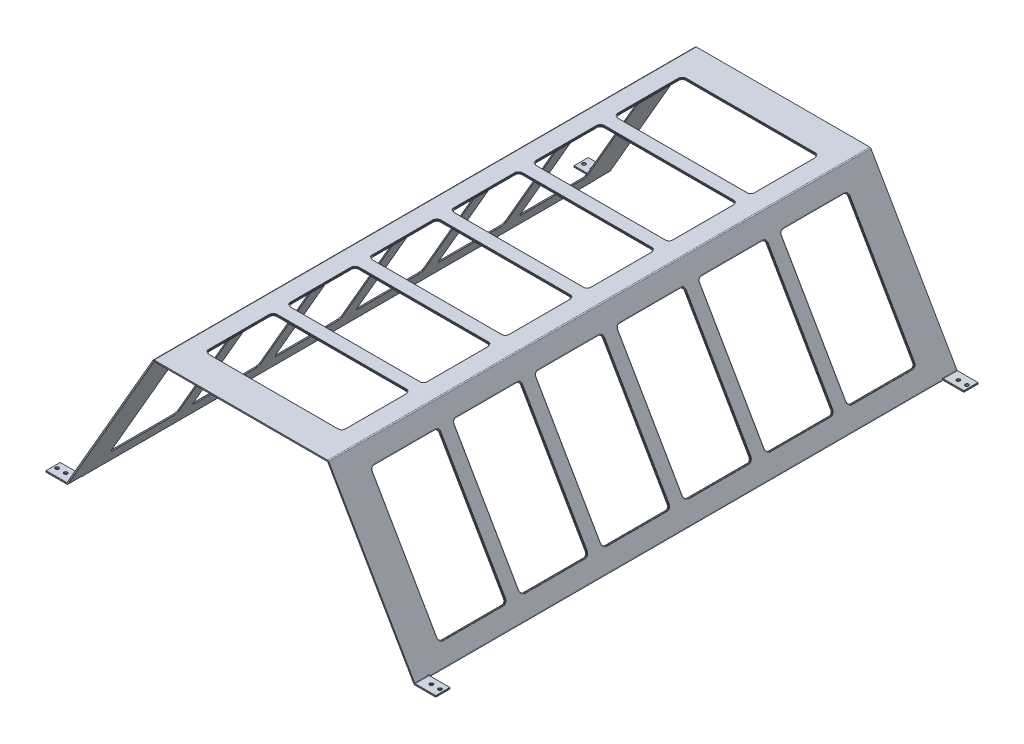
from build123d import *

# Parameters (mm, degrees)
EXTRUDE_1_DEPTH            = 633
EXTRUDE_1_DEPTH_BACK       = 633
EXTRUDE_2_DEPTH            = 633
EXTRUDE_2_DEPTH_BACK       = 633
SHEET_START                = -633
SHEET_METAL_1_DEPTH        = 1266
SHEET_METAL_1_2_DEPTH      = 1266
SHEET_METAL_2_DEPTH        = 1266
SHEET_METAL_2_2_DEPTH      = 1266
SM_START                   = -633
SM_EDGE_FLANGE_1_DEPTH     = 33.75
SM_START_2                 = -600
SM_EDGE_FLANGE_1_2_DEPTH   = 0.75
SM_EDGE_FLANGE_1_3_DEPTH   = 33
SM_EDGE_FLANGE_3_DEPTH     = 33.75
SM_EDGE_FLANGE_3_2_DEPTH   = 0.75
SM_EDGE_FLANGE_3_3_DEPTH   = 33
SKETCH_26_W                = 33
SKETCH_26_H                = 1.5
EXTRUDE_5_DEPTH            = 0.866025
SKETCH_20_W                = 33
SKETCH_20_H                = 1.5
EXTRUDE_1_2_DEPTH          = 1.299038106
SKETCH_27_W                = 33
SKETCH_27_H                = 1.5
EXTRUDE_6_DEPTH            = 0.866025404
SKETCH_23_W                = 33
SKETCH_23_H                = 1.5
EXTRUDE_2_2_DEPTH          = 1.299038106
MIRROR_START               = -633
MIRROR_2_COPY_1_DEPTH      = 33.75
MIRROR_START_2             = -600
MIRROR_2_COPY_2_DEPTH      = 0.75
MIRROR_2_COPY_3_DEPTH      = 33
SKETCH_28_W                = 33
SKETCH_28_H                = 1.5
EXTRUDE_7_DEPTH            = 0.866025404
SKETCH_29_W                = 33
SKETCH_29_H                = 1.5
EXTRUDE_8_DEPTH            = 0.866025404
MIRROR_4_COPY_1_DEPTH      = 33.75
MIRROR_4_COPY_2_DEPTH      = 0.75
MIRROR_4_COPY_3_DEPTH      = 33
SKETCH_24_W                = 33
SKETCH_24_H                = 1.5
EXTRUDE_3_DEPTH            = 1.299038106
SKETCH_25_W                = 33
SKETCH_25_H                = 1.5
EXTRUDE_4_DEPTH            = 1.299038106
CUT_EXTRUDE_1_DEPTH        = 856.137078446
CUT_EXTRUDE_1_DEPTH_BACK   = 856.137078446
SKETCH_9_R                 = 4
OTHER_START                = 356.740288533
OTHER_3_DEPTH              = 3
OTHER_START_2              = 358.240288533
OTHER_3_2_DEPTH            = 1.5
PATTERN_LINEAR_2_COUNT     = 3
PATTERN_LINEAR_2_PITCH     = 191
MIRROR_START_3             = 356.740288533
MIRROR_5_DEPTH             = 3
MIRROR_START_4             = 358.240288533
MIRROR_5_2_DEPTH           = 1.5
PATTERN_START              = -356.740288533
PATTERN_CIRCULAR_2_DEPTH   = 3
PATTERN_CIRCULAR_2_2_DEPTH = 1.5
PATTERN_START_2            = 353.740288533
PATTERN_CIRCULAR_2_3_DEPTH = 3
PATTERN_START_3            = 355.240288533
PATTERN_CIRCULAR_2_4_DEPTH = 1.5


# Read off the part's stored shape, not the designer's step: Преобразовать-Твердое тело1, Преобразовать-Твердое тело2, Ребро-кромка1, Ребро-кромка3, Полость3, Зеркальное отражение5, Круговой массив2
with BuildPart() as part:
    # Sketch 1 → Extrude 1 (new, two sides: drawn at the far end of the back side and taken through both)
    with BuildSketch(Plane.XY.offset(-EXTRUDE_1_DEPTH_BACK)):
        Polygon((405, 6), (202.5, 356.740288533), (-202.5, 356.740288533), (-405, 6), (-406.299038106, 6.75), (-203.366025404, 358.240288533), (203.366025404, 358.240288533), (406.299038106, 6.75), align=None)
    extrude(amount=EXTRUDE_1_DEPTH + EXTRUDE_1_DEPTH_BACK)

    # Sheet Metal 1 outline → Sheet Metal 1 (cut)
    with BuildSketch(Plane.XY.offset(SHEET_START)):
        with BuildLine():
            Line((203.366025404, 358.240288533), (201.633974596, 358.240288533))
            ThreePointArc((201.633974596, 358.240288533), (203.133974596, 357.838364744), (204.232050808, 356.740288533))
            Line((204.232050808, 356.740288533), (203.366025404, 358.240288533))
        make_face()
        with BuildLine():
            ThreePointArc((-204.232050808, 356.740288533), (-203.133974596, 357.838364744), (-201.633974596, 358.240288533))
            Line((-201.633974596, 358.240288533), (-203.366025404, 358.240288533))
            Line((-203.366025404, 358.240288533), (-204.232050808, 356.740288533))
        make_face()
    extrude(amount=SHEET_METAL_1_DEPTH, mode=Mode.SUBTRACT)

    # Sheet Metal 1 2 outline → Sheet Metal 1 2 (add)
    with BuildSketch(Plane.XY.offset(SHEET_START)):
        with BuildLine():
            Line((202.5, 356.740288533), (201.633974596, 356.740288533))
            ThreePointArc((201.633974596, 356.740288533), (202.383974596, 356.539326638), (202.933012702, 355.990288533))
            Line((202.933012702, 355.990288533), (202.5, 356.740288533))
        make_face()
        with BuildLine():
            ThreePointArc((-202.933012702, 355.990288533), (-202.383974596, 356.539326638), (-201.633974596, 356.740288533))
            Line((-201.633974596, 356.740288533), (-202.5, 356.740288533))
            Line((-202.5, 356.740288533), (-202.933012702, 355.990288533))
        make_face()
    extrude(amount=SHEET_METAL_1_2_DEPTH)

    # Ребро-кромка1 outline → Ребро-кромка1 (cut)
    with BuildSketch(Plane.XY.offset(SM_START)):
        with BuildLine():
            Line((-405, 6), (-403.700961894, 8.25))
            ThreePointArc((-403.700961894, 8.25), (-404.799038106, 7.151923789), (-406.299038106, 6.75))
            Line((-406.299038106, 6.75), (-405, 6))
        make_face()
    sm_edge_flange_1 = extrude(amount=SM_EDGE_FLANGE_1_DEPTH, mode=Mode.SUBTRACT)

    # Sm Edge Flange 1 2 outline → Sm Edge Flange 1 2 (cut)
    with BuildSketch(Plane.XY.offset(SM_START_2)):
        with BuildLine():
            Line((-403.325961894, 8.899519053), (-404.625, 9.649519053))
            Line((-404.625, 9.649519053), (-406.299038106, 6.75))
            ThreePointArc((-406.299038106, 6.75), (-404.799038106, 7.151923789), (-403.700961894, 8.25))
            Line((-403.700961894, 8.25), (-403.325961894, 8.899519053))
        make_face()
    sm_edge_flange_1_2 = extrude(amount=SM_EDGE_FLANGE_1_2_DEPTH, mode=Mode.SUBTRACT)

    # Sm Edge Flange 1 3 outline → Sm Edge Flange 1 3 (add)
    with BuildSketch(Plane.XY.offset(SM_START)):
        with BuildLine():
            Line((-406.299038106, 6.75), (-405, 9))
            ThreePointArc((-405, 9), (-405.549038106, 8.450961894), (-406.299038106, 8.25))
            Line((-406.299038106, 8.25), (-454.133974596, 8.25))
            Line((-454.133974596, 8.25), (-454.133974596, 6.75))
            Line((-454.133974596, 6.75), (-406.299038106, 6.75))
        make_face()
    sm_edge_flange_1_3 = extrude(amount=SM_EDGE_FLANGE_1_3_DEPTH)

    # Эскиз26 → Бобышка-Вытянуть5 (add)
    with BuildSketch(Plane.ZY.offset(454.133974596)):
        with Locations((-616.5, 7.5)):
            Rectangle(SKETCH_26_W, SKETCH_26_H)
    extrude(amount=EXTRUDE_5_DEPTH)

    # Зеркальное отражение1: Ребро-кромка1, Sm Edge Flange 1 2 across plane
    add(sm_edge_flange_1.mirror(Plane.XY), mode=Mode.SUBTRACT)
    add(sm_edge_flange_1_2.mirror(Plane.XY), mode=Mode.SUBTRACT)

    # Mirror 1 2: Sm Edge Flange 1 3 across plane
    add(sm_edge_flange_1_3.mirror(Plane.XY))

    # Эскиз27 → Бобышка-Вытянуть6 (add)
    with BuildSketch(Plane.ZY.offset(454.133974596)):
        with Locations((616.5, 7.5)):
            Rectangle(SKETCH_27_W, SKETCH_27_H)
    extrude(amount=EXTRUDE_6_DEPTH)

    # Зеркальное отражение2: Ребро-кромка1, Sm Edge Flange 1 2, Sm Edge Flange 1 3 across plane
    add(sm_edge_flange_1.mirror(Plane(origin=(0, 0, 0), x_dir=(0, 0, 1), z_dir=(1, 0, 0))), mode=Mode.SUBTRACT)
    add(sm_edge_flange_1_2.mirror(Plane(origin=(0, 0, 0), x_dir=(0, 0, 1), z_dir=(1, 0, 0))), mode=Mode.SUBTRACT)
    add(sm_edge_flange_1_3.mirror(Plane(origin=(0, 0, 0), x_dir=(0, 0, 1), z_dir=(1, 0, 0))))

    # Зеркальное отражение2 copy 1 sketch → Зеркальное отражение2 copy 1 (cut)
    with BuildSketch(Plane(origin=(0, 0, 0), x_dir=(-1, 0, 0), z_dir=(0, 0, -1)).offset(MIRROR_START)):
        with BuildLine():
            Line((-405, 6), (-403.700961894, 8.25))
            ThreePointArc((-403.700961894, 8.25), (-404.799038106, 7.151923789), (-406.299038106, 6.75))
            Line((-406.299038106, 6.75), (-405, 6))
        make_face()
    extrude(amount=MIRROR_2_COPY_1_DEPTH, mode=Mode.SUBTRACT)

    # Зеркальное отражение2 copy 2 sketch → Зеркальное отражение2 copy 2 (cut)
    with BuildSketch(Plane(origin=(0, 0, 0), x_dir=(-1, 0, 0), z_dir=(0, 0, -1)).offset(MIRROR_START_2)):
        with BuildLine():
            Line((-403.325961894, 8.899519053), (-404.625, 9.649519053))
            Line((-404.625, 9.649519053), (-406.299038106, 6.75))
            ThreePointArc((-406.299038106, 6.75), (-404.799038106, 7.151923789), (-403.700961894, 8.25))
            Line((-403.700961894, 8.25), (-403.325961894, 8.899519053))
        make_face()
    extrude(amount=MIRROR_2_COPY_2_DEPTH, mode=Mode.SUBTRACT)

    # Зеркальное отражение2 copy 3 sketch → Зеркальное отражение2 copy 3 (add)
    with BuildSketch(Plane(origin=(0, 0, 0), x_dir=(-1, 0, 0), z_dir=(0, 0, -1)).offset(MIRROR_START)):
        with BuildLine():
            Line((-406.299038106, 6.75), (-405, 9))
            ThreePointArc((-405, 9), (-405.549038106, 8.450961894), (-406.299038106, 8.25))
            Line((-406.299038106, 8.25), (-454.133974596, 8.25))
            Line((-454.133974596, 8.25), (-454.133974596, 6.75))
            Line((-454.133974596, 6.75), (-406.299038106, 6.75))
        make_face()
    extrude(amount=MIRROR_2_COPY_3_DEPTH)

    # Эскиз28 → Бобышка-Вытянуть7 (add)
    with BuildSketch(Plane(origin=(454.133974596, 0, 0), x_dir=(0, 0, -1), z_dir=(1, 0, 0))):
        with Locations((616.5, 7.5)):
            Rectangle(SKETCH_28_W, SKETCH_28_H)
    extrude(amount=EXTRUDE_7_DEPTH)

    # Эскиз29 → Бобышка-Вытянуть8 (add)
    with BuildSketch(Plane(origin=(454.133974596, 0, 0), x_dir=(0, 0, -1), z_dir=(1, 0, 0))):
        with Locations((-616.5, 7.5)):
            Rectangle(SKETCH_29_W, SKETCH_29_H)
    extrude(amount=EXTRUDE_8_DEPTH)


with BuildPart() as body_2:
    # Эскиз11 → Extrude 2 (new, two sides: drawn at the far end of the back side and taken through both)
    with BuildSketch(Plane.XY.offset(-EXTRUDE_2_DEPTH_BACK)):
        Polygon((405.299038106, 8.482050808), (203.366025404, 358.240288533), (-203.366025404, 358.240288533), (-405.299038106, 8.482050808), (-406.598076211, 9.232050808), (-204.232050808, 359.740288533), (204.232050808, 359.740288533), (406.598076211, 9.232050808), align=None)
    extrude(amount=EXTRUDE_2_DEPTH + EXTRUDE_2_DEPTH_BACK)

    # Sheet Metal 2 outline → Sheet Metal 2 (cut)
    with BuildSketch(Plane.XY.offset(SHEET_START)):
        with BuildLine():
            ThreePointArc((-205.098076211, 358.240288533), (-204, 359.338364744), (-202.5, 359.740288533))
            Line((-202.5, 359.740288533), (-204.232050808, 359.740288533))
            Line((-204.232050808, 359.740288533), (-205.098076211, 358.240288533))
        make_face()
        with BuildLine():
            ThreePointArc((202.5, 359.740288533), (204, 359.338364744), (205.098076211, 358.240288533))
            Line((205.098076211, 358.240288533), (204.232050808, 359.740288533))
            Line((204.232050808, 359.740288533), (202.5, 359.740288533))
        make_face()
    extrude(amount=SHEET_METAL_2_DEPTH, mode=Mode.SUBTRACT)

    # Sheet Metal 2 2 outline → Sheet Metal 2 2 (add)
    with BuildSketch(Plane.XY.offset(SHEET_START)):
        with BuildLine():
            ThreePointArc((-203.799038106, 357.490288533), (-203.25, 358.039326638), (-202.5, 358.240288533))
            Line((-202.5, 358.240288533), (-203.366025404, 358.240288533))
            Line((-203.366025404, 358.240288533), (-203.799038106, 357.490288533))
        make_face()
        with BuildLine():
            ThreePointArc((202.5, 358.240288533), (203.25, 358.039326638), (203.799038106, 357.490288533))
            Line((203.799038106, 357.490288533), (203.366025404, 358.240288533))
            Line((203.366025404, 358.240288533), (202.5, 358.240288533))
        make_face()
    extrude(amount=SHEET_METAL_2_2_DEPTH)

    # Ребро-кромка3 outline → Ребро-кромка3 (cut)
    with BuildSketch(Plane.XY.offset(SM_START)):
        with BuildLine():
            Line((-405.299038106, 8.482050808), (-404.433012702, 9.982050808))
            ThreePointArc((-404.433012702, 9.982050808), (-405.009426897, 9.265548452), (-405.775793973, 8.757305936))
            Line((-405.775793973, 8.757305936), (-405.299038106, 8.482050808))
        make_face()
    sm_edge_flange_3 = extrude(amount=SM_EDGE_FLANGE_3_DEPTH, mode=Mode.SUBTRACT)

    # Sm Edge Flange 3 2 outline → Sm Edge Flange 3 2 (cut)
    with BuildSketch(Plane.XY.offset(SM_START_2)):
        with BuildLine():
            Line((-404.058012702, 10.63156986), (-405.357050808, 11.38156986))
            Line((-405.357050808, 11.38156986), (-406.598076211, 9.232050808))
            Line((-406.598076211, 9.232050808), (-405.775793973, 8.757305936))
            ThreePointArc((-405.775793973, 8.757305936), (-405.009426897, 9.265548452), (-404.433012702, 9.982050808))
            Line((-404.433012702, 9.982050808), (-404.058012702, 10.63156986))
        make_face()
    sm_edge_flange_3_2 = extrude(amount=SM_EDGE_FLANGE_3_2_DEPTH, mode=Mode.SUBTRACT)

    # Sm Edge Flange 3 3 outline → Sm Edge Flange 3 3 (add)
    with BuildSketch(Plane.XY.offset(SM_START)):
        with BuildLine():
            Line((-406.598076211, 9.232050808), (-405.732050808, 10.732050808))
            ThreePointArc((-405.732050808, 10.732050808), (-406.281088913, 10.183012702), (-407.031088913, 9.982050808))
            Line((-407.031088913, 9.982050808), (-453.700961894, 9.982050808))
            Line((-453.700961894, 9.982050808), (-453.700961894, 8.482050808))
            Line((-453.700961894, 8.482050808), (-407.031088913, 8.482050808))
            ThreePointArc((-407.031088913, 8.482050808), (-406.388529427, 8.551672452), (-405.775793973, 8.757305936))
            Line((-405.775793973, 8.757305936), (-406.598076211, 9.232050808))
        make_face()
    sm_edge_flange_3_3 = extrude(amount=SM_EDGE_FLANGE_3_3_DEPTH)

    # Эскиз20 → Extrude 1 2 (add)
    with BuildSketch(Plane.ZY.offset(453.700961894)):
        with Locations((-616.5, 9.232050808)):
            Rectangle(SKETCH_20_W, SKETCH_20_H)
    extrude(amount=EXTRUDE_1_2_DEPTH)

    # Зеркальное отражение3: Ребро-кромка3, Sm Edge Flange 3 2 across plane
    add(sm_edge_flange_3.mirror(Plane.XY), mode=Mode.SUBTRACT)
    add(sm_edge_flange_3_2.mirror(Plane.XY), mode=Mode.SUBTRACT)

    # Mirror 3 2: Sm Edge Flange 3 3 across plane
    add(sm_edge_flange_3_3.mirror(Plane.XY))

    # Эскиз23 → Extrude 2 2 (add)
    with BuildSketch(Plane.ZY.offset(453.700961894)):
        with Locations((616.5, 9.232050808)):
            Rectangle(SKETCH_23_W, SKETCH_23_H)
    extrude(amount=EXTRUDE_2_2_DEPTH)

    # Зеркальное отражение4: Ребро-кромка3, Sm Edge Flange 3 2, Sm Edge Flange 3 3 across plane
    add(sm_edge_flange_3.mirror(Plane(origin=(0, 0, 0), x_dir=(0, 0, 1), z_dir=(1, 0, 0))), mode=Mode.SUBTRACT)
    add(sm_edge_flange_3_2.mirror(Plane(origin=(0, 0, 0), x_dir=(0, 0, 1), z_dir=(1, 0, 0))), mode=Mode.SUBTRACT)
    add(sm_edge_flange_3_3.mirror(Plane(origin=(0, 0, 0), x_dir=(0, 0, 1), z_dir=(1, 0, 0))))

    # Зеркальное отражение4 copy 1 sketch → Зеркальное отражение4 copy 1 (cut)
    with BuildSketch(Plane(origin=(0, 0, 0), x_dir=(-1, 0, 0), z_dir=(0, 0, -1)).offset(MIRROR_START)):
        with BuildLine():
            Line((-405.299038106, 8.482050808), (-404.433012702, 9.982050808))
            ThreePointArc((-404.433012702, 9.982050808), (-405.009426897, 9.265548452), (-405.775793973, 8.757305936))
            Line((-405.775793973, 8.757305936), (-405.299038106, 8.482050808))
        make_face()
    extrude(amount=MIRROR_4_COPY_1_DEPTH, mode=Mode.SUBTRACT)

    # Зеркальное отражение4 copy 2 sketch → Зеркальное отражение4 copy 2 (cut)
    with BuildSketch(Plane(origin=(0, 0, 0), x_dir=(-1, 0, 0), z_dir=(0, 0, -1)).offset(MIRROR_START_2)):
        with BuildLine():
            Line((-404.058012702, 10.63156986), (-405.357050808, 11.38156986))
            Line((-405.357050808, 11.38156986), (-406.598076211, 9.232050808))
            Line((-406.598076211, 9.232050808), (-405.775793973, 8.757305936))
            ThreePointArc((-405.775793973, 8.757305936), (-405.009426897, 9.265548452), (-404.433012702, 9.982050808))
            Line((-404.433012702, 9.982050808), (-404.058012702, 10.63156986))
        make_face()
    extrude(amount=MIRROR_4_COPY_2_DEPTH, mode=Mode.SUBTRACT)

    # Зеркальное отражение4 copy 3 sketch → Зеркальное отражение4 copy 3 (add)
    with BuildSketch(Plane(origin=(0, 0, 0), x_dir=(-1, 0, 0), z_dir=(0, 0, -1)).offset(MIRROR_START)):
        with BuildLine():
            Line((-406.598076211, 9.232050808), (-405.732050808, 10.732050808))
            ThreePointArc((-405.732050808, 10.732050808), (-406.281088913, 10.183012702), (-407.031088913, 9.982050808))
            Line((-407.031088913, 9.982050808), (-453.700961894, 9.982050808))
            Line((-453.700961894, 9.982050808), (-453.700961894, 8.482050808))
            Line((-453.700961894, 8.482050808), (-407.031088913, 8.482050808))
            ThreePointArc((-407.031088913, 8.482050808), (-406.388529427, 8.551672452), (-405.775793973, 8.757305936))
            Line((-405.775793973, 8.757305936), (-406.598076211, 9.232050808))
        make_face()
    extrude(amount=MIRROR_4_COPY_3_DEPTH)

    # Эскиз24 → Бобышка-Вытянуть3 (add)
    with BuildSketch(Plane(origin=(453.700961894, 0, 0), x_dir=(0, 0, -1), z_dir=(1, 0, 0))):
        with Locations((616.5, 9.232050808)):
            Rectangle(SKETCH_24_W, SKETCH_24_H)
    extrude(amount=EXTRUDE_3_DEPTH)

    # Эскиз25 → Бобышка-Вытянуть4 (add)
    with BuildSketch(Plane(origin=(453.700961894, 0, 0), x_dir=(0, 0, -1), z_dir=(1, 0, 0))):
        with Locations((-616.5, 9.232050808)):
            Rectangle(SKETCH_25_W, SKETCH_25_H)
    extrude(amount=EXTRUDE_4_DEPTH)


with BuildPart() as cut_extrude_1_tool:
    # Эскиз9 → Вырез-Вытянуть1 (new, two sides: drawn at the far end of the back side and taken through both)
    with BuildSketch(Plane(origin=(0, 8.25, 0), x_dir=(1, 0, 0), z_dir=(0, 1, 0)).offset(-CUT_EXTRUDE_1_DEPTH_BACK)):
        with Locations(Location((-447, 615, 0), (0, 0, 180))):
            Circle(SKETCH_9_R)
        with Locations(Location((-427, 615, 0), (0, 0, 180))):
            Circle(SKETCH_9_R)
        with Locations(Location((-447, -615, 0), (0, 0, 180))):
            Circle(SKETCH_9_R)
        with Locations(Location((-427, -615, 0), (0, 0, 180))):
            Circle(SKETCH_9_R)
        with Locations(Location((427, -615, 0), (0, 0, 180))):
            Circle(SKETCH_9_R)
        with Locations(Location((447, -615, 0), (0, 0, 180))):
            Circle(SKETCH_9_R)
        with Locations(Location((447, 615, 0), (0, 0, 180))):
            Circle(SKETCH_9_R)
        with Locations(Location((427, 615, 0), (0, 0, 180))):
            Circle(SKETCH_9_R)
    extrude(amount=CUT_EXTRUDE_1_DEPTH + CUT_EXTRUDE_1_DEPTH_BACK)


with BuildPart() as part_1:
    add(part.part)

    # Вырез-Вытянуть1: cut by cut_extrude_1_tool
    add(cut_extrude_1_tool.part, mode=Mode.SUBTRACT)


with BuildPart() as body_2_1:
    add(body_2.part)

    # Вырез-Вытянуть1: cut by cut_extrude_1_tool
    add(cut_extrude_1_tool.part, mode=Mode.SUBTRACT)


with BuildPart() as other_3_tool:
    # Полость3 outline → Полость3 (new body)
    with BuildSketch(Plane(origin=(0, 0, 0), x_dir=(1, 0, 0), z_dir=(0, 1, 0)).offset(OTHER_START)):
        with BuildLine():
            Line((158.5, 25), (158.5, 166))
            ThreePointArc((158.5, 166), (156.156854249, 171.656854249), (150.5, 174))
            Line((150.5, 174), (-150.5, 174))
            ThreePointArc((-150.5, 174), (-156.156854249, 171.656854249), (-158.5, 166))
            Line((-158.5, 166), (-158.5, 25))
            ThreePointArc((-158.5, 25), (-156.156854249, 19.343145751), (-150.5, 17))
            Line((-150.5, 17), (150.5, 17))
            ThreePointArc((150.5, 17), (156.156854249, 19.343145751), (158.5, 25))
        make_face()
    other_3 = extrude(amount=OTHER_3_DEPTH)


with BuildPart() as part_2:
    add(part_1.part)

    # Полость3: cut by other_3_tool
    add(other_3_tool.part, mode=Mode.SUBTRACT)


with BuildPart() as body_2_2:
    add(body_2_1.part)

    # Полость3: cut by other_3_tool
    add(other_3_tool.part, mode=Mode.SUBTRACT)

    # Other 3 2 outline → Other 3 2 (cut)
    with BuildSketch(Plane(origin=(0, 0, 0), x_dir=(1, 0, 0), z_dir=(0, 1, 0)).offset(OTHER_START_2)):
        with BuildLine():
            ThreePointArc((160.5, 166), (157.571067812, 173.071067812), (150.5, 176))
            Line((150.5, 176), (-150.5, 176))
            ThreePointArc((-150.5, 176), (-157.571067812, 173.071067812), (-160.5, 166))
            Line((-160.5, 166), (-160.5, 25))
            ThreePointArc((-160.5, 25), (-157.571067812, 17.928932188), (-150.5, 15))
            Line((-150.5, 15), (150.5, 15))
            ThreePointArc((150.5, 15), (157.571067812, 17.928932188), (160.5, 25))
            Line((160.5, 25), (160.5, 166))
        make_face()
        with BuildLine():
            ThreePointArc((150.5, 174), (156.156854249, 171.656854249), (158.5, 166))
            Line((158.5, 166), (158.5, 25))
            ThreePointArc((158.5, 25), (156.156854249, 19.343145751), (150.5, 17))
            Line((150.5, 17), (-150.5, 17))
            ThreePointArc((-150.5, 17), (-156.156854249, 19.343145751), (-158.5, 25))
            Line((-158.5, 25), (-158.5, 166))
            ThreePointArc((-158.5, 166), (-156.156854249, 171.656854249), (-150.5, 174))
            Line((-150.5, 174), (150.5, 174))
        make_face(mode=Mode.SUBTRACT)
    other_3_2 = extrude(amount=OTHER_3_2_DEPTH, mode=Mode.SUBTRACT)


with BuildPart() as pattern_linear_2_tool:
    # Линейный массив2: Полость3, Other 3 2 ×3
    with Locations(*[(0, 0, -i * PATTERN_LINEAR_2_PITCH) for i in range(1, PATTERN_LINEAR_2_COUNT)]):
        add(other_3)
        add(other_3_2)


with BuildPart() as part_3:
    add(part_2.part)

    # Линейный массив2: cut by pattern_linear_2_tool
    add(pattern_linear_2_tool.part, mode=Mode.SUBTRACT)


with BuildPart() as body_2_3:
    add(body_2_2.part)

    # Линейный массив2: cut by pattern_linear_2_tool
    add(pattern_linear_2_tool.part, mode=Mode.SUBTRACT)


with BuildPart() as mirror_5_tool:
    # Зеркальное отражение5 outline → Зеркальное отражение5 (new body)
    with BuildSketch(Plane(origin=(0, 0, 0), x_dir=(1, 0, 0), z_dir=(0, 1, 0)).offset(MIRROR_START_3)):
        with BuildLine():
            ThreePointArc((150.5, -365), (156.156854249, -362.656854249), (158.5, -357))
            Line((158.5, -357), (158.5, -216))
            ThreePointArc((158.5, -216), (156.156854249, -210.343145751), (150.5, -208))
            Line((150.5, -208), (-150.5, -208))
            ThreePointArc((-150.5, -208), (-156.156854249, -210.343145751), (-158.5, -216))
            Line((-158.5, -216), (-158.5, -357))
            ThreePointArc((-158.5, -357), (-156.156854249, -362.656854249), (-150.5, -365))
            Line((-150.5, -365), (150.5, -365))
        make_face()
        with BuildLine():
            ThreePointArc((150.5, -174), (156.156854249, -171.656854249), (158.5, -166))
            Line((158.5, -166), (158.5, -25))
            ThreePointArc((158.5, -25), (156.156854249, -19.343145751), (150.5, -17))
            Line((150.5, -17), (-150.5, -17))
            ThreePointArc((-150.5, -17), (-156.156854249, -19.343145751), (-158.5, -25))
            Line((-158.5, -25), (-158.5, -166))
            ThreePointArc((-158.5, -166), (-156.156854249, -171.656854249), (-150.5, -174))
            Line((-150.5, -174), (150.5, -174))
        make_face()
        with BuildLine():
            ThreePointArc((150.5, -556), (156.156854249, -553.656854249), (158.5, -548))
            Line((158.5, -548), (158.5, -407))
            ThreePointArc((158.5, -407), (156.156854249, -401.343145751), (150.5, -399))
            Line((150.5, -399), (-150.5, -399))
            ThreePointArc((-150.5, -399), (-156.156854249, -401.343145751), (-158.5, -407))
            Line((-158.5, -407), (-158.5, -548))
            ThreePointArc((-158.5, -548), (-156.156854249, -553.656854249), (-150.5, -556))
            Line((-150.5, -556), (150.5, -556))
        make_face()
    extrude(amount=MIRROR_5_DEPTH)


with BuildPart() as part_4:
    add(part_3.part)

    # Зеркальное отражение5: cut by mirror_5_tool
    add(mirror_5_tool.part, mode=Mode.SUBTRACT)


with BuildPart() as body_2_4:
    add(body_2_3.part)

    # Зеркальное отражение5: cut by mirror_5_tool
    add(mirror_5_tool.part, mode=Mode.SUBTRACT)

    # Mirror 5 2 outline → Mirror 5 2 (cut)
    # profile 1 of 3: a face of its own
    with BuildSketch(Plane(origin=(0, 0, 0), x_dir=(1, 0, 0), z_dir=(0, 1, 0)).offset(MIRROR_START_4)):
        with BuildLine():
            ThreePointArc((-150.5, -206), (-157.571067812, -208.928932188), (-160.5, -216))
            Line((-160.5, -216), (-160.5, -357))
            ThreePointArc((-160.5, -357), (-157.571067812, -364.071067812), (-150.5, -367))
            Line((-150.5, -367), (150.5, -367))
            ThreePointArc((150.5, -367), (157.571067812, -364.071067812), (160.5, -357))
            Line((160.5, -357), (160.5, -216))
            ThreePointArc((160.5, -216), (157.571067812, -208.928932188), (150.5, -206))
            Line((150.5, -206), (-150.5, -206))
        make_face()
        with BuildLine():
            Line((158.5, -216), (158.5, -357))
            ThreePointArc((158.5, -357), (156.156854249, -362.656854249), (150.5, -365))
            Line((150.5, -365), (-150.5, -365))
            ThreePointArc((-150.5, -365), (-156.156854249, -362.656854249), (-158.5, -357))
            Line((-158.5, -357), (-158.5, -216))
            ThreePointArc((-158.5, -216), (-156.156854249, -210.343145751), (-150.5, -208))
            Line((-150.5, -208), (150.5, -208))
            ThreePointArc((150.5, -208), (156.156854249, -210.343145751), (158.5, -216))
        make_face(mode=Mode.SUBTRACT)
    # profile 2 of 3: a face of its own
    with BuildSketch(Plane(origin=(0, 0, 0), x_dir=(1, 0, 0), z_dir=(0, 1, 0)).offset(MIRROR_START_4)):
        with BuildLine():
            ThreePointArc((-150.5, -15), (-157.571067812, -17.928932188), (-160.5, -25))
            Line((-160.5, -25), (-160.5, -166))
            ThreePointArc((-160.5, -166), (-157.571067812, -173.071067812), (-150.5, -176))
            Line((-150.5, -176), (150.5, -176))
            ThreePointArc((150.5, -176), (157.571067812, -173.071067812), (160.5, -166))
            Line((160.5, -166), (160.5, -25))
            ThreePointArc((160.5, -25), (157.571067812, -17.928932188), (150.5, -15))
            Line((150.5, -15), (-150.5, -15))
        make_face()
        with BuildLine():
            Line((158.5, -25), (158.5, -166))
            ThreePointArc((158.5, -166), (156.156854249, -171.656854249), (150.5, -174))
            Line((150.5, -174), (-150.5, -174))
            ThreePointArc((-150.5, -174), (-156.156854249, -171.656854249), (-158.5, -166))
            Line((-158.5, -166), (-158.5, -25))
            ThreePointArc((-158.5, -25), (-156.156854249, -19.343145751), (-150.5, -17))
            Line((-150.5, -17), (150.5, -17))
            ThreePointArc((150.5, -17), (156.156854249, -19.343145751), (158.5, -25))
        make_face(mode=Mode.SUBTRACT)
    # profile 3 of 3: a face of its own
    with BuildSketch(Plane(origin=(0, 0, 0), x_dir=(1, 0, 0), z_dir=(0, 1, 0)).offset(MIRROR_START_4)):
        with BuildLine():
            ThreePointArc((-150.5, -397), (-157.571067812, -399.928932188), (-160.5, -407))
            Line((-160.5, -407), (-160.5, -548))
            ThreePointArc((-160.5, -548), (-157.571067812, -555.071067812), (-150.5, -558))
            Line((-150.5, -558), (150.5, -558))
            ThreePointArc((150.5, -558), (157.571067812, -555.071067812), (160.5, -548))
            Line((160.5, -548), (160.5, -407))
            ThreePointArc((160.5, -407), (157.571067812, -399.928932188), (150.5, -397))
            Line((150.5, -397), (-150.5, -397))
        make_face()
        with BuildLine():
            Line((158.5, -407), (158.5, -548))
            ThreePointArc((158.5, -548), (156.156854249, -553.656854249), (150.5, -556))
            Line((150.5, -556), (-150.5, -556))
            ThreePointArc((-150.5, -556), (-156.156854249, -553.656854249), (-158.5, -548))
            Line((-158.5, -548), (-158.5, -407))
            ThreePointArc((-158.5, -407), (-156.156854249, -401.343145751), (-150.5, -399))
            Line((-150.5, -399), (150.5, -399))
            ThreePointArc((150.5, -399), (156.156854249, -401.343145751), (158.5, -407))
        make_face(mode=Mode.SUBTRACT)
    extrude(amount=MIRROR_5_2_DEPTH, mode=Mode.SUBTRACT)


with BuildPart() as pattern_circular_2_tool:
    # Круговой массив2 outline → Круговой массив2 (new body)
    with BuildSketch(Plane(origin=(0, 0, 0), x_dir=(0.5000000000000098, 0.8660254037844329, 0), z_dir=(0.8660254037844329, -0.50000000000001, 0)).offset(PATTERN_START)):
        with BuildLine():
            ThreePointArc((163.696152423, -25), (161.353006672, -19.343145751), (155.696152423, -17))
            Line((155.696152423, -17), (-145.303847577, -17))
            ThreePointArc((-145.303847577, -17), (-150.960701827, -19.34314575), (-153.303847577, -25))
            Line((-153.303847577, -25), (-153.303847577, -166))
            ThreePointArc((-153.303847577, -166), (-150.960701827, -171.656854249), (-145.303847577, -174))
            Line((-145.303847577, -174), (155.696152423, -174))
            ThreePointArc((155.696152423, -174), (161.353006672, -171.656854249), (163.696152423, -166))
            Line((163.696152423, -166), (163.696152423, -25))
        make_face()
        with BuildLine():
            ThreePointArc((163.696152423, -407), (161.353006672, -401.343145751), (155.696152423, -399))
            Line((155.696152423, -399), (-145.303847577, -399))
            ThreePointArc((-145.303847577, -399), (-150.960701827, -401.343145751), (-153.303847577, -407))
            Line((-153.303847577, -407), (-153.303847577, -548))
            ThreePointArc((-153.303847577, -548), (-150.960701827, -553.65685425), (-145.303847577, -556))
            Line((-145.303847577, -556), (155.696152423, -556))
            ThreePointArc((155.696152423, -556), (161.353006672, -553.656854249), (163.696152423, -548))
            Line((163.696152423, -548), (163.696152423, -407))
        make_face()
        with BuildLine():
            ThreePointArc((163.696152423, -216), (161.353006672, -210.343145751), (155.696152423, -208))
            Line((155.696152423, -208), (-145.303847577, -208))
            ThreePointArc((-145.303847577, -208), (-150.960701827, -210.343145751), (-153.303847577, -216))
            Line((-153.303847577, -216), (-153.303847577, -357))
            ThreePointArc((-153.303847577, -357), (-150.960701827, -362.656854249), (-145.303847577, -365))
            Line((-145.303847577, -365), (155.696152423, -365))
            ThreePointArc((155.696152423, -365), (161.353006672, -362.656854249), (163.696152423, -357))
            Line((163.696152423, -357), (163.696152423, -216))
        make_face()
        with BuildLine():
            ThreePointArc((-153.303847577, 216), (-150.960701827, 210.343145751), (-145.303847577, 208))
            Line((-145.303847577, 208), (155.696152423, 208))
            ThreePointArc((155.696152423, 208), (161.353006672, 210.343145751), (163.696152423, 216))
            Line((163.696152423, 216), (163.696152423, 357))
            ThreePointArc((163.696152423, 357), (161.353006672, 362.656854249), (155.696152423, 365))
            Line((155.696152423, 365), (-145.303847577, 365))
            ThreePointArc((-145.303847577, 365), (-150.960701827, 362.656854249), (-153.303847577, 357))
            Line((-153.303847577, 357), (-153.303847577, 216))
        make_face()
        with BuildLine():
            ThreePointArc((-153.303847577, 25), (-150.960701827, 19.34314575), (-145.303847577, 17))
            Line((-145.303847577, 17), (155.696152423, 17))
            ThreePointArc((155.696152423, 17), (161.353006672, 19.343145751), (163.696152423, 25))
            Line((163.696152423, 25), (163.696152423, 166))
            ThreePointArc((163.696152423, 166), (161.353006672, 171.656854249), (155.696152423, 174))
            Line((155.696152423, 174), (-145.303847577, 174))
            ThreePointArc((-145.303847577, 174), (-150.960701827, 171.656854249), (-153.303847577, 166))
            Line((-153.303847577, 166), (-153.303847577, 25))
        make_face()
        with BuildLine():
            ThreePointArc((-153.303847577, 407), (-150.960701827, 401.343145751), (-145.303847577, 399))
            Line((-145.303847577, 399), (155.696152423, 399))
            ThreePointArc((155.696152423, 399), (161.353006672, 401.343145751), (163.696152423, 407))
            Line((163.696152423, 407), (163.696152423, 548))
            ThreePointArc((163.696152423, 548), (161.353006672, 553.656854249), (155.696152423, 556))
            Line((155.696152423, 556), (-145.303847577, 556))
            ThreePointArc((-145.303847577, 556), (-150.960701827, 553.65685425), (-153.303847577, 548))
            Line((-153.303847577, 548), (-153.303847577, 407))
        make_face()
    extrude(amount=PATTERN_CIRCULAR_2_DEPTH)


with BuildPart() as part_5:
    add(part_4.part)

    # Круговой массив2: cut by pattern_circular_2_tool
    add(pattern_circular_2_tool.part, mode=Mode.SUBTRACT)


with BuildPart() as body_2_5:
    add(body_2_4.part)

    # Круговой массив2: cut by pattern_circular_2_tool
    add(pattern_circular_2_tool.part, mode=Mode.SUBTRACT)

    # Pattern Circular 2 2 outline → Pattern Circular 2 2 (cut)
    # profile 1 of 6: a face of its own
    with BuildSketch(Plane(origin=(0, 0, 0), x_dir=(0.5000000000000098, 0.8660254037844329, 0), z_dir=(0.8660254037844329, -0.50000000000001, 0)).offset(PATTERN_START)):
        with BuildLine():
            ThreePointArc((-155.303847577, -166), (-152.374915389, -173.071067812), (-145.303847577, -176))
            Line((-145.303847577, -176), (155.696152423, -176))
            ThreePointArc((155.696152423, -176), (162.767220235, -173.071067812), (165.696152423, -166))
            Line((165.696152423, -166), (165.696152423, -25))
            ThreePointArc((165.696152423, -25), (162.767220235, -17.928932188), (155.696152423, -15))
            Line((155.696152423, -15), (-145.303847577, -15))
            ThreePointArc((-145.303847577, -15), (-152.374915389, -17.928932188), (-155.303847577, -25))
            Line((-155.303847577, -25), (-155.303847577, -166))
        make_face()
        with BuildLine():
            Line((-145.303847577, -17), (155.696152423, -17))
            ThreePointArc((155.696152423, -17), (161.353006672, -19.343145751), (163.696152423, -25))
            Line((163.696152423, -25), (163.696152423, -166))
            ThreePointArc((163.696152423, -166), (161.353006672, -171.656854249), (155.696152423, -174))
            Line((155.696152423, -174), (-145.303847577, -174))
            ThreePointArc((-145.303847577, -174), (-150.960701827, -171.656854249), (-153.303847577, -166))
            Line((-153.303847577, -166), (-153.303847577, -25))
            ThreePointArc((-153.303847577, -25), (-150.960701827, -19.34314575), (-145.303847577, -17))
        make_face(mode=Mode.SUBTRACT)
    # profile 2 of 6: a face of its own
    with BuildSketch(Plane(origin=(0, 0, 0), x_dir=(0.5000000000000098, 0.8660254037844329, 0), z_dir=(0.8660254037844329, -0.50000000000001, 0)).offset(PATTERN_START)):
        with BuildLine():
            ThreePointArc((-155.303847577, -548), (-152.374915389, -555.071067812), (-145.303847577, -558))
            Line((-145.303847577, -558), (155.696152423, -558))
            ThreePointArc((155.696152423, -558), (162.767220235, -555.071067812), (165.696152423, -548))
            Line((165.696152423, -548), (165.696152423, -407))
            ThreePointArc((165.696152423, -407), (162.767220235, -399.928932188), (155.696152423, -397))
            Line((155.696152423, -397), (-145.303847577, -397))
            ThreePointArc((-145.303847577, -397), (-152.374915389, -399.928932188), (-155.303847577, -407))
            Line((-155.303847577, -407), (-155.303847577, -548))
        make_face()
        with BuildLine():
            Line((-145.303847577, -399), (155.696152423, -399))
            ThreePointArc((155.696152423, -399), (161.353006672, -401.343145751), (163.696152423, -407))
            Line((163.696152423, -407), (163.696152423, -548))
            ThreePointArc((163.696152423, -548), (161.353006672, -553.656854249), (155.696152423, -556))
            Line((155.696152423, -556), (-145.303847577, -556))
            ThreePointArc((-145.303847577, -556), (-150.960701827, -553.65685425), (-153.303847577, -548))
            Line((-153.303847577, -548), (-153.303847577, -407))
            ThreePointArc((-153.303847577, -407), (-150.960701827, -401.343145751), (-145.303847577, -399))
        make_face(mode=Mode.SUBTRACT)
    # profile 3 of 6: a face of its own
    with BuildSketch(Plane(origin=(0, 0, 0), x_dir=(0.5000000000000098, 0.8660254037844329, 0), z_dir=(0.8660254037844329, -0.50000000000001, 0)).offset(PATTERN_START)):
        with BuildLine():
            ThreePointArc((-155.303847577, -357), (-152.374915389, -364.071067812), (-145.303847577, -367))
            Line((-145.303847577, -367), (155.696152423, -367))
            ThreePointArc((155.696152423, -367), (162.767220235, -364.071067812), (165.696152423, -357))
            Line((165.696152423, -357), (165.696152423, -216))
            ThreePointArc((165.696152423, -216), (162.767220235, -208.928932188), (155.696152423, -206))
            Line((155.696152423, -206), (-145.303847577, -206))
            ThreePointArc((-145.303847577, -206), (-152.374915389, -208.928932188), (-155.303847577, -216))
            Line((-155.303847577, -216), (-155.303847577, -357))
        make_face()
        with BuildLine():
            Line((-145.303847577, -208), (155.696152423, -208))
            ThreePointArc((155.696152423, -208), (161.353006672, -210.343145751), (163.696152423, -216))
            Line((163.696152423, -216), (163.696152423, -357))
            ThreePointArc((163.696152423, -357), (161.353006672, -362.656854249), (155.696152423, -365))
            Line((155.696152423, -365), (-145.303847577, -365))
            ThreePointArc((-145.303847577, -365), (-150.960701827, -362.656854249), (-153.303847577, -357))
            Line((-153.303847577, -357), (-153.303847577, -216))
            ThreePointArc((-153.303847577, -216), (-150.960701827, -210.343145751), (-145.303847577, -208))
        make_face(mode=Mode.SUBTRACT)
    # profile 4 of 6: a face of its own
    with BuildSketch(Plane(origin=(0, 0, 0), x_dir=(0.5000000000000098, 0.8660254037844329, 0), z_dir=(0.8660254037844329, -0.50000000000001, 0)).offset(PATTERN_START)):
        with BuildLine():
            ThreePointArc((165.696152423, 357), (162.767220235, 364.071067812), (155.696152423, 367))
            Line((155.696152423, 367), (-145.303847577, 367))
            ThreePointArc((-145.303847577, 367), (-152.374915389, 364.071067812), (-155.303847577, 357))
            Line((-155.303847577, 357), (-155.303847577, 216))
            ThreePointArc((-155.303847577, 216), (-152.374915389, 208.928932188), (-145.303847577, 206))
            Line((-145.303847577, 206), (155.696152423, 206))
            ThreePointArc((155.696152423, 206), (162.767220235, 208.928932188), (165.696152423, 216))
            Line((165.696152423, 216), (165.696152423, 357))
        make_face()
        with BuildLine():
            Line((155.696152423, 208), (-145.303847577, 208))
            ThreePointArc((-145.303847577, 208), (-150.960701827, 210.343145751), (-153.303847577, 216))
            Line((-153.303847577, 216), (-153.303847577, 357))
            ThreePointArc((-153.303847577, 357), (-150.960701827, 362.656854249), (-145.303847577, 365))
            Line((-145.303847577, 365), (155.696152423, 365))
            ThreePointArc((155.696152423, 365), (161.353006672, 362.656854249), (163.696152423, 357))
            Line((163.696152423, 357), (163.696152423, 216))
            ThreePointArc((163.696152423, 216), (161.353006672, 210.343145751), (155.696152423, 208))
        make_face(mode=Mode.SUBTRACT)
    # profile 5 of 6: a face of its own
    with BuildSketch(Plane(origin=(0, 0, 0), x_dir=(0.5000000000000098, 0.8660254037844329, 0), z_dir=(0.8660254037844329, -0.50000000000001, 0)).offset(PATTERN_START)):
        with BuildLine():
            ThreePointArc((165.696152423, 166), (162.767220235, 173.071067812), (155.696152423, 176))
            Line((155.696152423, 176), (-145.303847577, 176))
            ThreePointArc((-145.303847577, 176), (-152.374915389, 173.071067812), (-155.303847577, 166))
            Line((-155.303847577, 166), (-155.303847577, 25))
            ThreePointArc((-155.303847577, 25), (-152.374915389, 17.928932188), (-145.303847577, 15))
            Line((-145.303847577, 15), (155.696152423, 15))
            ThreePointArc((155.696152423, 15), (162.767220235, 17.928932188), (165.696152423, 25))
            Line((165.696152423, 25), (165.696152423, 166))
        make_face()
        with BuildLine():
            Line((155.696152423, 17), (-145.303847577, 17))
            ThreePointArc((-145.303847577, 17), (-150.960701827, 19.34314575), (-153.303847577, 25))
            Line((-153.303847577, 25), (-153.303847577, 166))
            ThreePointArc((-153.303847577, 166), (-150.960701827, 171.656854249), (-145.303847577, 174))
            Line((-145.303847577, 174), (155.696152423, 174))
            ThreePointArc((155.696152423, 174), (161.353006672, 171.656854249), (163.696152423, 166))
            Line((163.696152423, 166), (163.696152423, 25))
            ThreePointArc((163.696152423, 25), (161.353006672, 19.343145751), (155.696152423, 17))
        make_face(mode=Mode.SUBTRACT)
    # profile 6 of 6: a face of its own
    with BuildSketch(Plane(origin=(0, 0, 0), x_dir=(0.5000000000000098, 0.8660254037844329, 0), z_dir=(0.8660254037844329, -0.50000000000001, 0)).offset(PATTERN_START)):
        with BuildLine():
            ThreePointArc((165.696152423, 548), (162.767220235, 555.071067812), (155.696152423, 558))
            Line((155.696152423, 558), (-145.303847577, 558))
            ThreePointArc((-145.303847577, 558), (-152.374915389, 555.071067812), (-155.303847577, 548))
            Line((-155.303847577, 548), (-155.303847577, 407))
            ThreePointArc((-155.303847577, 407), (-152.374915389, 399.928932188), (-145.303847577, 397))
            Line((-145.303847577, 397), (155.696152423, 397))
            ThreePointArc((155.696152423, 397), (162.767220235, 399.928932188), (165.696152423, 407))
            Line((165.696152423, 407), (165.696152423, 548))
        make_face()
        with BuildLine():
            Line((155.696152423, 399), (-145.303847577, 399))
            ThreePointArc((-145.303847577, 399), (-150.960701827, 401.343145751), (-153.303847577, 407))
            Line((-153.303847577, 407), (-153.303847577, 548))
            ThreePointArc((-153.303847577, 548), (-150.960701827, 553.65685425), (-145.303847577, 556))
            Line((-145.303847577, 556), (155.696152423, 556))
            ThreePointArc((155.696152423, 556), (161.353006672, 553.656854249), (163.696152423, 548))
            Line((163.696152423, 548), (163.696152423, 407))
            ThreePointArc((163.696152423, 407), (161.353006672, 401.343145751), (155.696152423, 399))
        make_face(mode=Mode.SUBTRACT)
    extrude(amount=PATTERN_CIRCULAR_2_2_DEPTH, mode=Mode.SUBTRACT)


with BuildPart() as pattern_circular_2_3_tool:
    # Pattern Circular 2 3 outline → Pattern Circular 2 3 (new body)
    with BuildSketch(Plane(origin=(0, 0, 0), x_dir=(0.49999999999999767, -0.86602540378444, 0), z_dir=(0.8660254037844399, 0.49999999999999795, 0)).offset(PATTERN_START_2)):
        with BuildLine():
            ThreePointArc((-163.696152423, 25), (-161.353006672, 19.343145751), (-155.696152423, 17))
            Line((-155.696152423, 17), (145.303847577, 17))
            ThreePointArc((145.303847577, 17), (150.960701827, 19.34314575), (153.303847577, 25))
            Line((153.303847577, 25), (153.303847577, 166))
            ThreePointArc((153.303847577, 166), (150.960701827, 171.656854249), (145.303847577, 174))
            Line((145.303847577, 174), (-155.696152423, 174))
            ThreePointArc((-155.696152423, 174), (-161.353006672, 171.656854249), (-163.696152423, 166))
            Line((-163.696152423, 166), (-163.696152423, 25))
        make_face()
        with BuildLine():
            ThreePointArc((-163.696152423, 407), (-161.353006672, 401.343145751), (-155.696152423, 399))
            Line((-155.696152423, 399), (145.303847577, 399))
            ThreePointArc((145.303847577, 399), (150.960701827, 401.343145751), (153.303847577, 407))
            Line((153.303847577, 407), (153.303847577, 548))
            ThreePointArc((153.303847577, 548), (150.960701827, 553.65685425), (145.303847577, 556))
            Line((145.303847577, 556), (-155.696152423, 556))
            ThreePointArc((-155.696152423, 556), (-161.353006672, 553.656854249), (-163.696152423, 548))
            Line((-163.696152423, 548), (-163.696152423, 407))
        make_face()
        with BuildLine():
            ThreePointArc((-163.696152423, 216), (-161.353006672, 210.343145751), (-155.696152423, 208))
            Line((-155.696152423, 208), (145.303847577, 208))
            ThreePointArc((145.303847577, 208), (150.960701827, 210.343145751), (153.303847577, 216))
            Line((153.303847577, 216), (153.303847577, 357))
            ThreePointArc((153.303847577, 357), (150.960701827, 362.656854249), (145.303847577, 365))
            Line((145.303847577, 365), (-155.696152423, 365))
            ThreePointArc((-155.696152423, 365), (-161.353006672, 362.656854249), (-163.696152423, 357))
            Line((-163.696152423, 357), (-163.696152423, 216))
        make_face()
        with BuildLine():
            ThreePointArc((153.303847577, -216), (150.960701827, -210.343145751), (145.303847577, -208))
            Line((145.303847577, -208), (-155.696152423, -208))
            ThreePointArc((-155.696152423, -208), (-161.353006672, -210.343145751), (-163.696152423, -216))
            Line((-163.696152423, -216), (-163.696152423, -357))
            ThreePointArc((-163.696152423, -357), (-161.353006672, -362.656854249), (-155.696152423, -365))
            Line((-155.696152423, -365), (145.303847577, -365))
            ThreePointArc((145.303847577, -365), (150.960701827, -362.656854249), (153.303847577, -357))
            Line((153.303847577, -357), (153.303847577, -216))
        make_face()
        with BuildLine():
            ThreePointArc((153.303847577, -25), (150.960701827, -19.34314575), (145.303847577, -17))
            Line((145.303847577, -17), (-155.696152423, -17))
            ThreePointArc((-155.696152423, -17), (-161.353006672, -19.343145751), (-163.696152423, -25))
            Line((-163.696152423, -25), (-163.696152423, -166))
            ThreePointArc((-163.696152423, -166), (-161.353006672, -171.656854249), (-155.696152423, -174))
            Line((-155.696152423, -174), (145.303847577, -174))
            ThreePointArc((145.303847577, -174), (150.960701827, -171.656854249), (153.303847577, -166))
            Line((153.303847577, -166), (153.303847577, -25))
        make_face()
        with BuildLine():
            ThreePointArc((153.303847577, -407), (150.960701827, -401.343145751), (145.303847577, -399))
            Line((145.303847577, -399), (-155.696152423, -399))
            ThreePointArc((-155.696152423, -399), (-161.353006672, -401.343145751), (-163.696152423, -407))
            Line((-163.696152423, -407), (-163.696152423, -548))
            ThreePointArc((-163.696152423, -548), (-161.353006672, -553.656854249), (-155.696152423, -556))
            Line((-155.696152423, -556), (145.303847577, -556))
            ThreePointArc((145.303847577, -556), (150.960701827, -553.65685425), (153.303847577, -548))
            Line((153.303847577, -548), (153.303847577, -407))
        make_face()
    extrude(amount=PATTERN_CIRCULAR_2_3_DEPTH)


with BuildPart() as part_6:
    add(part_5.part)

    # Pattern Circular 2 3: cut by pattern_circular_2_3_tool
    add(pattern_circular_2_3_tool.part, mode=Mode.SUBTRACT)


with BuildPart() as body_2_6:
    add(body_2_5.part)

    # Pattern Circular 2 3: cut by pattern_circular_2_3_tool
    add(pattern_circular_2_3_tool.part, mode=Mode.SUBTRACT)

    # Pattern Circular 2 4 outline → Pattern Circular 2 4 (cut)
    # profile 1 of 6: a face of its own
    with BuildSketch(Plane(origin=(0, 0, 0), x_dir=(0.49999999999999767, -0.86602540378444, 0), z_dir=(0.8660254037844399, 0.49999999999999795, 0)).offset(PATTERN_START_3)):
        with BuildLine():
            ThreePointArc((155.303847577, 166), (152.374915389, 173.071067812), (145.303847577, 176))
            Line((145.303847577, 176), (-155.696152423, 176))
            ThreePointArc((-155.696152423, 176), (-162.767220235, 173.071067812), (-165.696152423, 166))
            Line((-165.696152423, 166), (-165.696152423, 25))
            ThreePointArc((-165.696152423, 25), (-162.767220235, 17.928932188), (-155.696152423, 15))
            Line((-155.696152423, 15), (145.303847577, 15))
            ThreePointArc((145.303847577, 15), (152.374915389, 17.928932188), (155.303847577, 25))
            Line((155.303847577, 25), (155.303847577, 166))
        make_face()
        with BuildLine():
            Line((145.303847577, 17), (-155.696152423, 17))
            ThreePointArc((-155.696152423, 17), (-161.353006672, 19.343145751), (-163.696152423, 25))
            Line((-163.696152423, 25), (-163.696152423, 166))
            ThreePointArc((-163.696152423, 166), (-161.353006672, 171.656854249), (-155.696152423, 174))
            Line((-155.696152423, 174), (145.303847577, 174))
            ThreePointArc((145.303847577, 174), (150.960701827, 171.656854249), (153.303847577, 166))
            Line((153.303847577, 166), (153.303847577, 25))
            ThreePointArc((153.303847577, 25), (150.960701827, 19.34314575), (145.303847577, 17))
        make_face(mode=Mode.SUBTRACT)
    # profile 2 of 6: a face of its own
    with BuildSketch(Plane(origin=(0, 0, 0), x_dir=(0.49999999999999767, -0.86602540378444, 0), z_dir=(0.8660254037844399, 0.49999999999999795, 0)).offset(PATTERN_START_3)):
        with BuildLine():
            ThreePointArc((155.303847577, 548), (152.374915389, 555.071067812), (145.303847577, 558))
            Line((145.303847577, 558), (-155.696152423, 558))
            ThreePointArc((-155.696152423, 558), (-162.767220235, 555.071067812), (-165.696152423, 548))
            Line((-165.696152423, 548), (-165.696152423, 407))
            ThreePointArc((-165.696152423, 407), (-162.767220235, 399.928932188), (-155.696152423, 397))
            Line((-155.696152423, 397), (145.303847577, 397))
            ThreePointArc((145.303847577, 397), (152.374915389, 399.928932188), (155.303847577, 407))
            Line((155.303847577, 407), (155.303847577, 548))
        make_face()
        with BuildLine():
            Line((145.303847577, 399), (-155.696152423, 399))
            ThreePointArc((-155.696152423, 399), (-161.353006672, 401.343145751), (-163.696152423, 407))
            Line((-163.696152423, 407), (-163.696152423, 548))
            ThreePointArc((-163.696152423, 548), (-161.353006672, 553.656854249), (-155.696152423, 556))
            Line((-155.696152423, 556), (145.303847577, 556))
            ThreePointArc((145.303847577, 556), (150.960701827, 553.65685425), (153.303847577, 548))
            Line((153.303847577, 548), (153.303847577, 407))
            ThreePointArc((153.303847577, 407), (150.960701827, 401.343145751), (145.303847577, 399))
        make_face(mode=Mode.SUBTRACT)
    # profile 3 of 6: a face of its own
    with BuildSketch(Plane(origin=(0, 0, 0), x_dir=(0.49999999999999767, -0.86602540378444, 0), z_dir=(0.8660254037844399, 0.49999999999999795, 0)).offset(PATTERN_START_3)):
        with BuildLine():
            ThreePointArc((155.303847577, 357), (152.374915389, 364.071067812), (145.303847577, 367))
            Line((145.303847577, 367), (-155.696152423, 367))
            ThreePointArc((-155.696152423, 367), (-162.767220235, 364.071067812), (-165.696152423, 357))
            Line((-165.696152423, 357), (-165.696152423, 216))
            ThreePointArc((-165.696152423, 216), (-162.767220235, 208.928932188), (-155.696152423, 206))
            Line((-155.696152423, 206), (145.303847577, 206))
            ThreePointArc((145.303847577, 206), (152.374915389, 208.928932188), (155.303847577, 216))
            Line((155.303847577, 216), (155.303847577, 357))
        make_face()
        with BuildLine():
            Line((145.303847577, 208), (-155.696152423, 208))
            ThreePointArc((-155.696152423, 208), (-161.353006672, 210.343145751), (-163.696152423, 216))
            Line((-163.696152423, 216), (-163.696152423, 357))
            ThreePointArc((-163.696152423, 357), (-161.353006672, 362.656854249), (-155.696152423, 365))
            Line((-155.696152423, 365), (145.303847577, 365))
            ThreePointArc((145.303847577, 365), (150.960701827, 362.656854249), (153.303847577, 357))
            Line((153.303847577, 357), (153.303847577, 216))
            ThreePointArc((153.303847577, 216), (150.960701827, 210.343145751), (145.303847577, 208))
        make_face(mode=Mode.SUBTRACT)
    # profile 4 of 6: a face of its own
    with BuildSketch(Plane(origin=(0, 0, 0), x_dir=(0.49999999999999767, -0.86602540378444, 0), z_dir=(0.8660254037844399, 0.49999999999999795, 0)).offset(PATTERN_START_3)):
        with BuildLine():
            ThreePointArc((-165.696152423, -357), (-162.767220235, -364.071067812), (-155.696152423, -367))
            Line((-155.696152423, -367), (145.303847577, -367))
            ThreePointArc((145.303847577, -367), (152.374915389, -364.071067812), (155.303847577, -357))
            Line((155.303847577, -357), (155.303847577, -216))
            ThreePointArc((155.303847577, -216), (152.374915389, -208.928932188), (145.303847577, -206))
            Line((145.303847577, -206), (-155.696152423, -206))
            ThreePointArc((-155.696152423, -206), (-162.767220235, -208.928932188), (-165.696152423, -216))
            Line((-165.696152423, -216), (-165.696152423, -357))
        make_face()
        with BuildLine():
            Line((-155.696152423, -208), (145.303847577, -208))
            ThreePointArc((145.303847577, -208), (150.960701827, -210.343145751), (153.303847577, -216))
            Line((153.303847577, -216), (153.303847577, -357))
            ThreePointArc((153.303847577, -357), (150.960701827, -362.656854249), (145.303847577, -365))
            Line((145.303847577, -365), (-155.696152423, -365))
            ThreePointArc((-155.696152423, -365), (-161.353006672, -362.656854249), (-163.696152423, -357))
            Line((-163.696152423, -357), (-163.696152423, -216))
            ThreePointArc((-163.696152423, -216), (-161.353006672, -210.343145751), (-155.696152423, -208))
        make_face(mode=Mode.SUBTRACT)
    # profile 5 of 6: a face of its own
    with BuildSketch(Plane(origin=(0, 0, 0), x_dir=(0.49999999999999767, -0.86602540378444, 0), z_dir=(0.8660254037844399, 0.49999999999999795, 0)).offset(PATTERN_START_3)):
        with BuildLine():
            ThreePointArc((-165.696152423, -166), (-162.767220235, -173.071067812), (-155.696152423, -176))
            Line((-155.696152423, -176), (145.303847577, -176))
            ThreePointArc((145.303847577, -176), (152.374915389, -173.071067812), (155.303847577, -166))
            Line((155.303847577, -166), (155.303847577, -25))
            ThreePointArc((155.303847577, -25), (152.374915389, -17.928932188), (145.303847577, -15))
            Line((145.303847577, -15), (-155.696152423, -15))
            ThreePointArc((-155.696152423, -15), (-162.767220235, -17.928932188), (-165.696152423, -25))
            Line((-165.696152423, -25), (-165.696152423, -166))
        make_face()
        with BuildLine():
            Line((-155.696152423, -17), (145.303847577, -17))
            ThreePointArc((145.303847577, -17), (150.960701827, -19.34314575), (153.303847577, -25))
            Line((153.303847577, -25), (153.303847577, -166))
            ThreePointArc((153.303847577, -166), (150.960701827, -171.656854249), (145.303847577, -174))
            Line((145.303847577, -174), (-155.696152423, -174))
            ThreePointArc((-155.696152423, -174), (-161.353006672, -171.656854249), (-163.696152423, -166))
            Line((-163.696152423, -166), (-163.696152423, -25))
            ThreePointArc((-163.696152423, -25), (-161.353006672, -19.343145751), (-155.696152423, -17))
        make_face(mode=Mode.SUBTRACT)
    # profile 6 of 6: a face of its own
    with BuildSketch(Plane(origin=(0, 0, 0), x_dir=(0.49999999999999767, -0.86602540378444, 0), z_dir=(0.8660254037844399, 0.49999999999999795, 0)).offset(PATTERN_START_3)):
        with BuildLine():
            ThreePointArc((-165.696152423, -548), (-162.767220235, -555.071067812), (-155.696152423, -558))
            Line((-155.696152423, -558), (145.303847577, -558))
            ThreePointArc((145.303847577, -558), (152.374915389, -555.071067812), (155.303847577, -548))
            Line((155.303847577, -548), (155.303847577, -407))
            ThreePointArc((155.303847577, -407), (152.374915389, -399.928932188), (145.303847577, -397))
            Line((145.303847577, -397), (-155.696152423, -397))
            ThreePointArc((-155.696152423, -397), (-162.767220235, -399.928932188), (-165.696152423, -407))
            Line((-165.696152423, -407), (-165.696152423, -548))
        make_face()
        with BuildLine():
            Line((-155.696152423, -399), (145.303847577, -399))
            ThreePointArc((145.303847577, -399), (150.960701827, -401.343145751), (153.303847577, -407))
            Line((153.303847577, -407), (153.303847577, -548))
            ThreePointArc((153.303847577, -548), (150.960701827, -553.65685425), (145.303847577, -556))
            Line((145.303847577, -556), (-155.696152423, -556))
            ThreePointArc((-155.696152423, -556), (-161.353006672, -553.656854249), (-163.696152423, -548))
            Line((-163.696152423, -548), (-163.696152423, -407))
            ThreePointArc((-163.696152423, -407), (-161.353006672, -401.343145751), (-155.696152423, -399))
        make_face(mode=Mode.SUBTRACT)
    extrude(amount=PATTERN_CIRCULAR_2_4_DEPTH, mode=Mode.SUBTRACT)


solid = Compound([part_6.part, body_2_6.part])
